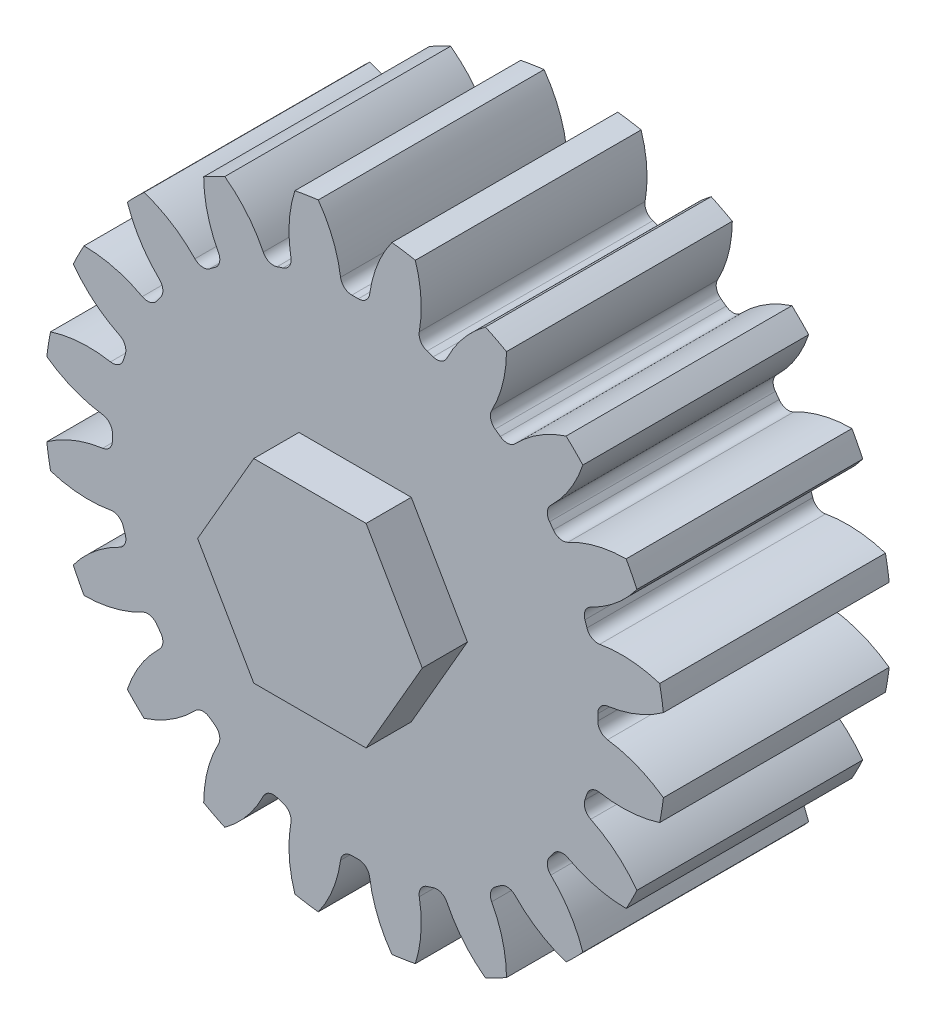
from build123d import *

# Parameters (mm, degrees)
SKETCH1_R                = 34.925
BOSS_EXTRUDE2_DEPTH      = 12.7
CUT_EXTRUDE3_DEPTH       = 56.539816798
FILLET1_R                = 1.27
FILLET2_R                = 1.27
CIRPATTERN2_COUNT        = 20
FILLET1_OF_CIRPATTERN2_R = 1.27
FILLET2_OF_CIRPATTERN2_R = 1.27
CUT_EXTRUDE4_DEPTH       = 51.660303503
CUT_EXTRUDE4_DEPTH_BACK  = 51.660303503
SKETCH1_4_R              = 2.54
BOSS_EXTRUDE3_DEPTH      = 5.08


with BuildPart() as part:
    # Sketch1 → Boss-Extrude2 (new, symmetric)
    with BuildSketch(Plane.XY):
        Circle(SKETCH1_R)
    extrude(amount=BOSS_EXTRUDE2_DEPTH, both=True)

    # Sketch2 → Cut-Extrude3 (cut, symmetric)
    with BuildSketch(Plane.XY.offset(12.7)):
        with BuildLine():
            ThreePointArc((4.143363091, 34.678353007), (0, 34.925), (-4.143363091, 34.678353007))
            ThreePointArc((-4.143363091, 34.678353007), (-2.305797051, 31.157002463), (-1.526035224, 27.262322746))
            ThreePointArc((-1.526035224, 27.262322746), (0, 27.305), (1.526035224, 27.262322746))
            ThreePointArc((1.526035224, 27.262322746), (2.305797051, 31.157002463), (4.143363091, 34.678353007))
        make_face()
    cut_extrude3 = extrude(amount=CUT_EXTRUDE3_DEPTH, both=True, mode=Mode.SUBTRACT)

    # Fillet1
    fillet1_edges = [part.edges().sort_by_distance(p)[0] for p in [
        (-1.526035224, 27.262322746, 0),
    ]]
    fillet(fillet1_edges, radius=FILLET1_R)

    # Fillet2
    fillet2_edges = [part.edges().sort_by_distance(p)[0] for p in [
        (1.526035224, 27.262322746, 0),
    ]]
    fillet(fillet2_edges, radius=FILLET2_R)

    # CirPattern2: Cut-Extrude3 ×20 about axis
    cirpattern2_axis = Axis((0, 0, 12.7), (0, 0, -1))
    for i in range(1, CIRPATTERN2_COUNT):
        add(cut_extrude3.rotate(cirpattern2_axis, i * 360 / CIRPATTERN2_COUNT), mode=Mode.SUBTRACT)

    # Fillet1 of CirPattern2
    fillet1_of_cirpattern2_edges = [part.edges().sort_by_distance(p)[0] for p in [
        (6.973175291, 26.399580515, 0),
        (14.789802823, 22.952663407, 0),
        (21.158701408, 17.258979683, 0),
        (25.456438879, 9.875866778, 0),
        (27.262322746, 1.526035224, 0),
        (26.399580515, -6.973175291, 0),
        (22.952663407, -14.789802823, 0),
        (17.258979683, -21.158701408, 0),
        (9.875866778, -25.456438879, 0),
        (1.526035224, -27.262322746, 0),
        (-6.973175291, -26.399580515, 0),
        (-14.789802823, -22.952663407, 0),
        (-21.158701408, -17.258979683, 0),
        (-25.456438879, -9.875866778, 0),
        (-27.262322746, -1.526035224, 0),
        (-26.399580515, 6.973175291, 0),
        (-22.952663407, 14.789802823, 0),
        (-17.258979683, 21.158701408, 0),
        (-9.875866778, 25.456438879, 0),
    ]]
    fillet(fillet1_of_cirpattern2_edges, radius=FILLET1_OF_CIRPATTERN2_R)

    # Fillet2 of CirPattern2
    fillet2_of_cirpattern2_edges = [part.edges().sort_by_distance(p)[0] for p in [
        (9.875866778, 25.456438879, 0),
        (17.258979683, 21.158701408, 0),
        (22.952663407, 14.789802823, 0),
        (26.399580515, 6.973175291, 0),
        (27.262322746, -1.526035224, 0),
        (25.456438879, -9.875866778, 0),
        (21.158701408, -17.258979683, 0),
        (14.789802823, -22.952663407, 0),
        (6.973175291, -26.399580515, 0),
        (-1.526035224, -27.262322746, 0),
        (-9.875866778, -25.456438879, 0),
        (-17.258979683, -21.158701408, 0),
        (-22.952663407, -14.789802823, 0),
        (-26.399580515, -6.973175291, 0),
        (-27.262322746, 1.526035224, 0),
        (-25.456438879, 9.875866778, 0),
        (-21.158701408, 17.258979683, 0),
        (-14.789802823, 22.952663407, 0),
        (-6.973175291, 26.399580515, 0),
    ]]
    fillet(fillet2_of_cirpattern2_edges, radius=FILLET2_OF_CIRPATTERN2_R)

    # Sketch1<4> → Cut-Extrude4 (cut, two sides: drawn at the far end of the back side and taken through both)
    with BuildSketch(Plane.XY.offset(-CUT_EXTRUDE4_DEPTH_BACK)):
        Circle(SKETCH1_4_R)
    extrude(amount=CUT_EXTRUDE4_DEPTH + CUT_EXTRUDE4_DEPTH_BACK, mode=Mode.SUBTRACT)

    # Sketch3 → Boss-Extrude3 (add)
    with BuildSketch(Plane.XY.offset(12.7)):
        Polygon((12.634064431, 0), (6.317032216, 10.941420751), (-6.317032216, 10.941420751), (-12.634064431, 0), (-6.317032216, -10.941420751), (6.317032216, -10.941420751), align=None)
    extrude(amount=BOSS_EXTRUDE3_DEPTH)


solid = part.part
